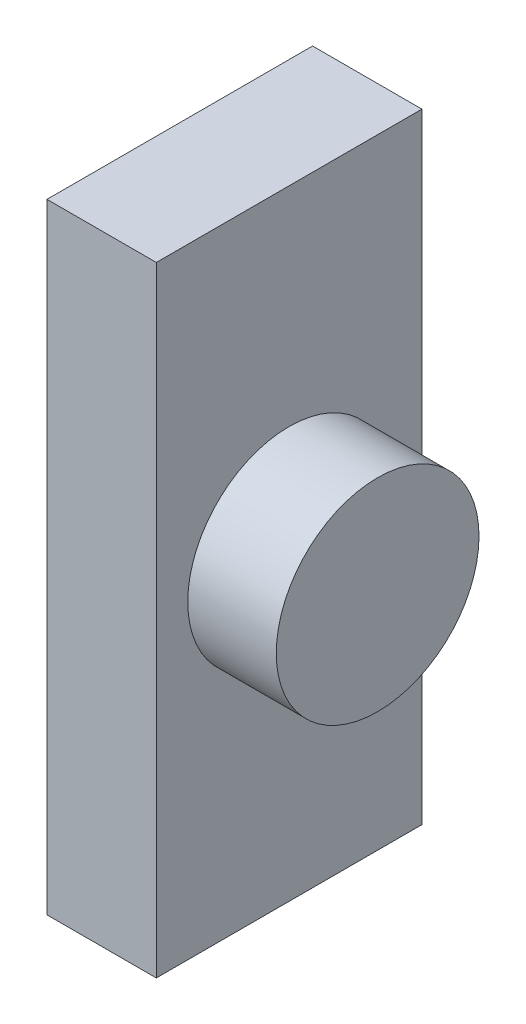
from build123d import *

# Parameters (mm, degrees)
SKETCH1_W           = 15
SKETCH1_H           = 35
SKETCH1_W_2         = 3.275
SKETCH1_H_2         = 13
BOSS_EXTRUDE1_DEPTH = 4.175
SKETCH2_W           = 15
SKETCH2_H           = 35
BOSS_EXTRUDE2_DEPTH = 2
SKETCH3_R           = 5.725
BOSS_EXTRUDE3_DEPTH = 5


with BuildPart() as part:
    # Sketch1 → Boss-Extrude1 (new body)
    with BuildSketch(Plane(origin=(0, 0, 0), x_dir=(0, 0, -1), z_dir=(1, 0, 0))):
        with Locations((7.5, 17.5)):
            Rectangle(SKETCH1_W, SKETCH1_H)
        with Locations((7.5, 17.5)):
            Rectangle(SKETCH1_W_2, SKETCH1_H_2, mode=Mode.SUBTRACT)
    extrude(amount=BOSS_EXTRUDE1_DEPTH)

    # Sketch2 → Boss-Extrude2 (add)
    with BuildSketch(Plane(origin=(4.175, 0, 0), x_dir=(0, 0, -1), z_dir=(1, 0, 0))):
        with Locations((7.5, 17.5)):
            Rectangle(SKETCH2_W, SKETCH2_H)
    extrude(amount=BOSS_EXTRUDE2_DEPTH)

    # Sketch3 → Boss-Extrude3 (add)
    with BuildSketch(Plane(origin=(6.175, 0, 0), x_dir=(0, 0, -1), z_dir=(1, 0, 0))):
        with Locations((7.5, 17.5)):
            Circle(SKETCH3_R)
    extrude(amount=BOSS_EXTRUDE3_DEPTH)


solid = part.part
